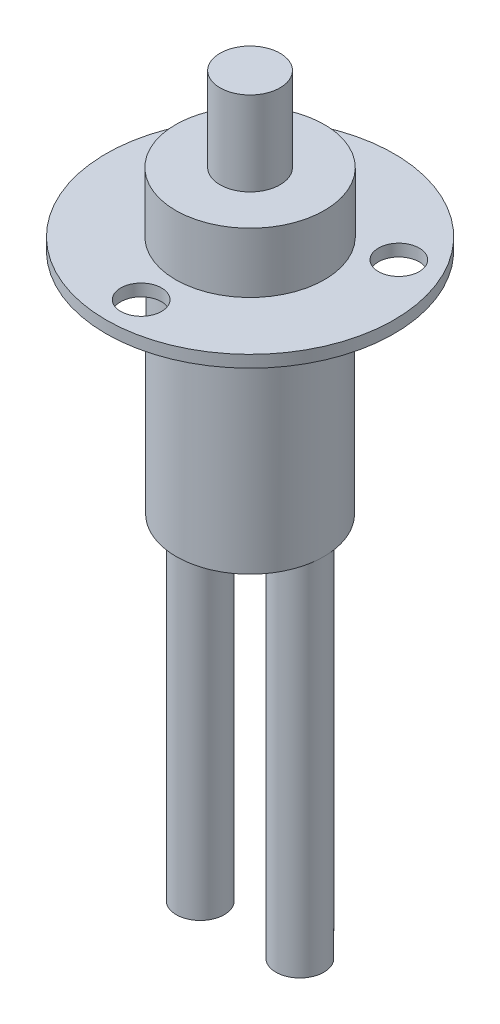
from build123d import *

# Parameters (mm, degrees)
SKETCH1_R            = 6.15
BOSS_EXTRUDE1_DEPTH  = 19
SKETCH2_R            = 12
BOSS_EXTRUDE2_DEPTH  = 1
SKETCH3_R            = 6.2
BOSS_EXTRUDE3_DEPTH  = 5
SKETCH4_R            = 2.5
BOSS_EXTRUDE4_DEPTH  = 7
SKETCH5_R            = 2
BOSS_EXTRUDE5_DEPTH  = 30
SKETCH6_R            = 1.5
CUT_EXTRUDE1_DEPTH   = 52.85556865
M3_CLEARANCE_HOLE1_D = 3.4


with BuildPart() as part:
    # Sketch1 → Boss-Extrude1 (new body)
    with BuildSketch(Plane(origin=(0, 0, 0), x_dir=(1, 0, 0), z_dir=(0, 1, 0))):
        Circle(SKETCH1_R)
    extrude(amount=BOSS_EXTRUDE1_DEPTH)

    # Sketch2 → Boss-Extrude2 (add)
    with BuildSketch(Plane(origin=(0, 19, 0), x_dir=(1, 0, 0), z_dir=(0, 1, 0))):
        Circle(SKETCH2_R)
    extrude(amount=BOSS_EXTRUDE2_DEPTH)

    # Sketch3 → Boss-Extrude3 (add)
    with BuildSketch(Plane(origin=(0, 20, 0), x_dir=(1, 0, 0), z_dir=(0, 1, 0))):
        Circle(SKETCH3_R)
    extrude(amount=BOSS_EXTRUDE3_DEPTH)

    # Sketch4 → Boss-Extrude4 (add)
    with BuildSketch(Plane(origin=(0, 25, 0), x_dir=(1, 0, 0), z_dir=(0, 1, 0))):
        Circle(SKETCH4_R)
    extrude(amount=BOSS_EXTRUDE4_DEPTH)

    # Sketch5 → Boss-Extrude5 (add)
    with BuildSketch(Plane.XZ):
        with Locations((-4.15, 0)):
            Circle(SKETCH5_R)
        with Locations((4.15, 0)):
            Circle(SKETCH5_R)
    extrude(amount=BOSS_EXTRUDE5_DEPTH)

    # Sketch6 → Cut-Extrude1 (cut, through all)
    with BuildSketch(Plane.XZ.offset(-19)):
        with Locations((0, 9.075)):
            Circle(SKETCH6_R)
        with Locations((7.859180539, -4.5375)):
            Circle(SKETCH6_R)
        with Locations((-7.859180539, -4.5375)):
            Circle(SKETCH6_R)
    extrude(amount=-CUT_EXTRUDE1_DEPTH, mode=Mode.SUBTRACT)

    # M3 Clearance Hole1 (through all)
    with Locations(Plane(origin=(0, 20, 0), x_dir=(1, 0, 0), z_dir=(0, 1, 0))):
        with Locations((7.859180539, 4.5375), (-7.859180539, 4.5375), (0, -9.075)):
            Hole(M3_CLEARANCE_HOLE1_D / 2)


solid = part.part
